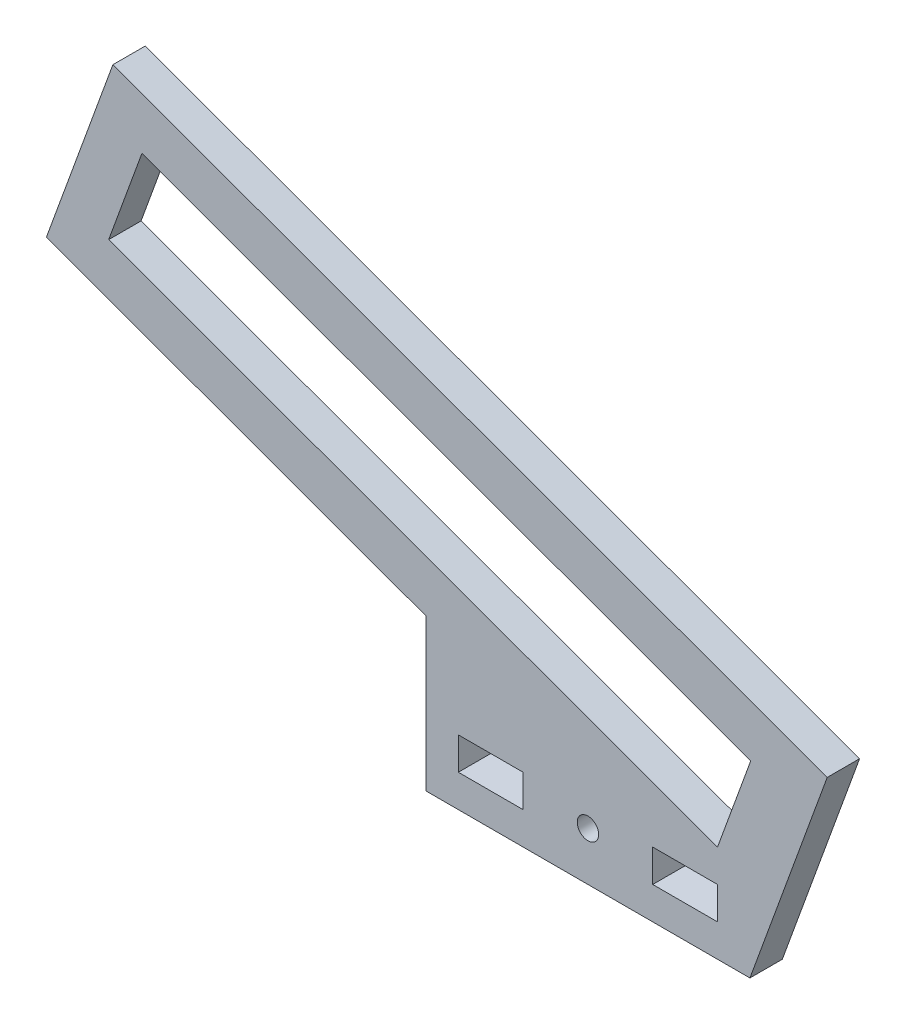
from build123d import *

# Parameters (mm, degrees)
SKETCH1_W               = 63.5
SKETCH1_H               = 19.05
BOSS_EXTRUDE1_DEPTH     = 6.35
SKETCH2_R               = 2.0955
SKETCH2_W               = 12.7
SKETCH2_H               = 6.35
CUT_EXTRUDE1_DEPTH      = 6.35
BOSS_EXTRUDE2_START     = -6.35
BOSS_EXTRUDE2_OUTLINE_W = 12.7
BOSS_EXTRUDE2_OUTLINE_H = 6.35
BOSS_EXTRUDE2_OUTLINE_R = 2.0955
BOSS_EXTRUDE2_DEPTH     = 6.35


with BuildPart() as part:
    # Sketch1 → Boss-Extrude1 (new body)
    with BuildSketch(Plane.XY):
        Rectangle(SKETCH1_W, SKETCH1_H)
    extrude(amount=BOSS_EXTRUDE1_DEPTH)

    # Sketch2 → Cut-Extrude1 (cut)
    with BuildSketch(Plane.XY.offset(6.35)):
        Circle(SKETCH2_R)
        with Locations((-19.05, 0)):
            Rectangle(SKETCH2_W, SKETCH2_H)
        with Locations((19.05, 0)):
            Rectangle(SKETCH2_W, SKETCH2_H)
    extrude(amount=-CUT_EXTRUDE1_DEPTH, mode=Mode.SUBTRACT)

    # Boss-Extrude2: read off the stored shape, not the designer's step
    # Boss-Extrude2 outline → Boss-Extrude2 (add)
    with BuildSketch(Plane.XY.offset(6.35).offset(BOSS_EXTRUDE2_START)):
        Polygon((-31.75, 20.189605605), (-31.75, -9.525), (31.75, -9.525), (46.902968685, 32.107439299), (-93.118309457, 83.071016706), (-106.149276918, 47.268727855), align=None)
        with Locations((-19.05, 0)):
            Rectangle(BOSS_EXTRUDE2_OUTLINE_W, BOSS_EXTRUDE2_OUTLINE_H, mode=Mode.SUBTRACT)
        Circle(BOSS_EXTRUDE2_OUTLINE_R, mode=Mode.SUBTRACT)
        with Locations((19.05, 0)):
            Rectangle(BOSS_EXTRUDE2_OUTLINE_W, BOSS_EXTRUDE2_OUTLINE_H, mode=Mode.SUBTRACT)
        Polygon((-87.425479109, 70.862702628), (31.91548373, 27.426144426), (25.4, 9.525), (-93.94096284, 52.961558202), align=None, mode=Mode.SUBTRACT)
    extrude(amount=BOSS_EXTRUDE2_DEPTH)


solid = part.part
